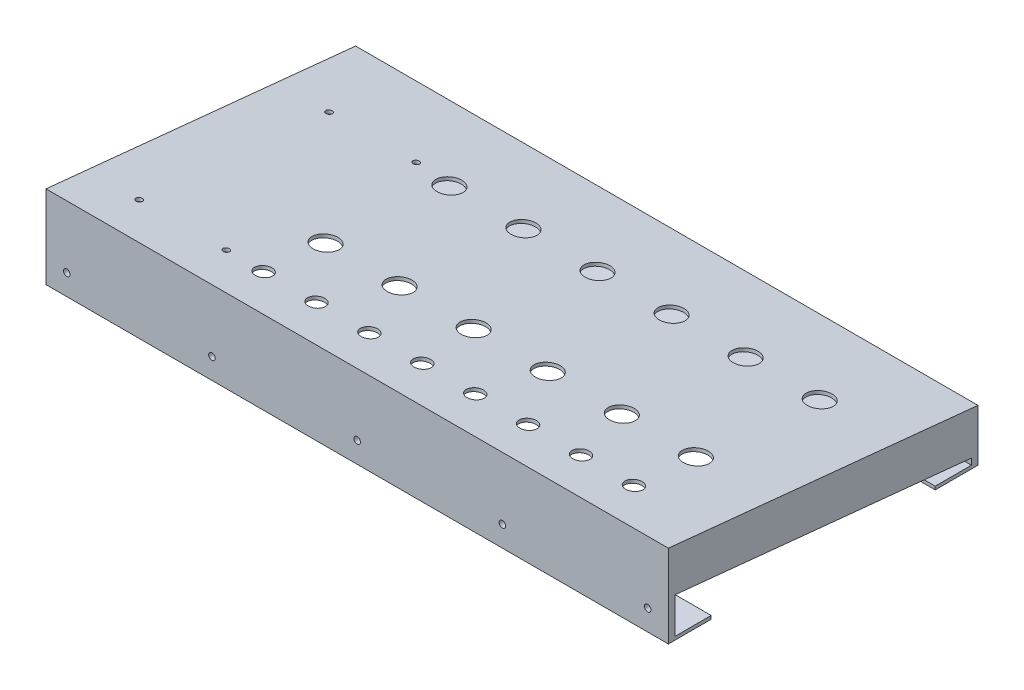
from build123d import *

# Parameters (mm, degrees)
BOSS_EXTRU_1_DEPTH      = 300
ESQUISSE3_W             = 300
ESQUISSE3_H             = 19.05
BOSS_EXTRU_2_DEPTH      = 1.5875
ESQUISSE4_W             = 300
ESQUISSE4_H             = 1.5875
BOSS_EXTRU_3_DEPTH      = 17.4625
ESQUISSE5_W             = 300
ESQUISSE5_H             = 19.05
BOSS_EXTRU_4_DEPTH      = 1.5875
ESQUISSE6_W             = 300
ESQUISSE6_H             = 1.5875
BOSS_EXTRU_5_DEPTH      = 17.4625
BOSS_EXTRU_6_DEPTH      = 19.05
BOSS_EXTRU_7_DEPTH      = 1.5875
BOSS_EXTRU_8_DEPTH      = 19.05
BOSS_EXTRU_9_DEPTH      = 1.5875
ESQUISSE12_R            = 1.5875
ENL_V_MAT_EXTRU_1_DEPTH = 336.963889684
ENL_V_MAT_EXTRU_2_REACH = 327.827
ESQUISSE13_R            = 4
ESQUISSE13_R_2          = 6
ESQUISSE13_R_3          = 1.5


with BuildPart() as part:
    # Esquisse1 → Boss.-Extru.1 (new body)
    with BuildSketch(Plane(origin=(0, 0, 0), x_dir=(0, 0, -1), z_dir=(1, 0, 0))):
        Polygon((-26.397970452, -24.428163497), (-26.397970452, 15.571836503), (122.850145114, 0.571836503), (122.850145114, -24.428163497), (121.262645114, -24.428163497), (121.262645114, -0.864111276), (-24.810470452, 13.816789218), (-24.810470452, -24.428163497), align=None)
    extrude(amount=BOSS_EXTRU_1_DEPTH)

    # Esquisse3 → Boss.-Extru.2 (add)
    with BuildSketch(Plane(origin=(0, 0, 24.810470452), x_dir=(-1, 0, 0), z_dir=(0, 0, -1))):
        with Locations((-150, -14.903163497)):
            Rectangle(ESQUISSE3_W, ESQUISSE3_H)
    extrude(amount=BOSS_EXTRU_2_DEPTH)

    # Esquisse4 → Boss.-Extru.3 (add)
    with BuildSketch(Plane(origin=(0, 0, 23.222970452), x_dir=(-1, 0, 0), z_dir=(0, 0, -1))):
        with Locations((-150, -23.634413497)):
            Rectangle(ESQUISSE4_W, ESQUISSE4_H)
    extrude(amount=BOSS_EXTRU_3_DEPTH)

    # Esquisse5 → Boss.-Extru.4 (add)
    with BuildSketch(Plane.XY.offset(-121.262645114)):
        with Locations((150, -14.903163497)):
            Rectangle(ESQUISSE5_W, ESQUISSE5_H)
    extrude(amount=BOSS_EXTRU_4_DEPTH)

    # Esquisse6 → Boss.-Extru.5 (add)
    with BuildSketch(Plane.XY.offset(-119.675145114)):
        with Locations((150, -23.634413497)):
            Rectangle(ESQUISSE6_W, ESQUISSE6_H)
    extrude(amount=BOSS_EXTRU_5_DEPTH)

    # Esquisse7 → Boss.-Extru.6 (add)
    with BuildSketch(Plane(origin=(300, 0, 0), x_dir=(0, 0, -1), z_dir=(1, 0, 0))):
        Polygon((-24.810470452, 13.816789218), (-24.810470452, 12.221291686), (121.262645114, -2.459608808), (121.262645114, -0.864111276), align=None)
    extrude(amount=-BOSS_EXTRU_6_DEPTH)

    # Esquisse8 → Boss.-Extru.7 (add)
    with BuildSketch(Plane(origin=(300, 0, 0), x_dir=(0, 0, -1), z_dir=(1, 0, 0))):
        Polygon((-24.810470452, 12.221291686), (121.262645114, -2.459608808), (121.262645114, -5.378163497), (119.675145114, -5.378163497), (119.675145114, -19.850531903), (-24.810470452, -5.329181163), align=None)
    extrude(amount=-BOSS_EXTRU_7_DEPTH)



with BuildPart() as body_2:
    # Esquisse9 → Boss.-Extru.8 (new body)
    with BuildSketch(Plane.ZY):
        Polygon((-121.262645114, -0.864111276), (24.810470452, 13.816789218), (24.810470452, 12.221291686), (-121.262645114, -2.459608808), align=None)
    extrude(amount=-BOSS_EXTRU_8_DEPTH)


with BuildPart() as part_1:
    add(part.part)

    add(body_2.part)  # Boss.-Extru.9 merges body 2
    # Esquisse11 → Boss.-Extru.9 (add)
    with BuildSketch(Plane.ZY):
        Polygon((-121.262645114, -2.459608808), (-121.262645114, -5.378163497), (-119.675145114, -5.378163497), (-119.675145114, -19.850531903), (24.810470452, -5.329181163), (24.810470452, 12.221291686), align=None)
    extrude(amount=-BOSS_EXTRU_9_DEPTH)

    # Esquisse12 → Enlèv. mat.-Extru.1 (cut, through all)
    with BuildSketch(Plane(origin=(0, 0, -122.850145114), x_dir=(-1, 0, 0), z_dir=(0, 0, -1))):
        with Locations((-290, -14.428163497)):
            Circle(ESQUISSE12_R)
        with Locations((-150, -14.428163497)):
            Circle(ESQUISSE12_R)
        with Locations((-10, -14.428163497)):
            Circle(ESQUISSE12_R)
        with Locations((-220, -14.428163497)):
            Circle(ESQUISSE12_R)
        with Locations((-80, -14.428163497)):
            Circle(ESQUISSE12_R)
    extrude(amount=-ENL_V_MAT_EXTRU_1_DEPTH, mode=Mode.SUBTRACT)

    # Esquisse13 → Enlèv. mat.-Extru.2 (cut, up to next)
    with BuildSketch(Plane(origin=(0, 12.789553241, -1.285398465), x_dir=(1, 0, 0), z_dir=(0, 0.99498743710662, -0.09999999999999984)), mode=Mode.PRIVATE) as enl_v_mat_extru_2_sk1:
        with Locations((263.5, -7.822832615)):
            Circle(ESQUISSE13_R)
    enl_v_mat_extru_2_tool1 = extrude(enl_v_mat_extru_2_sk1.sketch, amount=-ENL_V_MAT_EXTRU_2_REACH, mode=Mode.PRIVATE) & part_1.part
    # Esquisse13 → Enlèv. mat.-Extru.2 (cut, up to next)
    with BuildSketch(Plane(origin=(0, 12.789553241, -1.285398465), x_dir=(1, 0, 0), z_dir=(0, 0.99498743710662, -0.09999999999999984)), mode=Mode.PRIVATE) as enl_v_mat_extru_2_sk2:
        with Locations((238, -7.822832615)):
            Circle(ESQUISSE13_R)
    enl_v_mat_extru_2_tool2 = extrude(enl_v_mat_extru_2_sk2.sketch, amount=-ENL_V_MAT_EXTRU_2_REACH, mode=Mode.PRIVATE) & part_1.part
    # Esquisse13 → Enlèv. mat.-Extru.2 (cut, up to next)
    with BuildSketch(Plane(origin=(0, 12.789553241, -1.285398465), x_dir=(1, 0, 0), z_dir=(0, 0.99498743710662, -0.09999999999999984)), mode=Mode.PRIVATE) as enl_v_mat_extru_2_sk3:
        with Locations((212.5, -7.822832615)):
            Circle(ESQUISSE13_R)
    enl_v_mat_extru_2_tool3 = extrude(enl_v_mat_extru_2_sk3.sketch, amount=-ENL_V_MAT_EXTRU_2_REACH, mode=Mode.PRIVATE) & part_1.part
    # Esquisse13 → Enlèv. mat.-Extru.2 (cut, up to next)
    with BuildSketch(Plane(origin=(0, 12.789553241, -1.285398465), x_dir=(1, 0, 0), z_dir=(0, 0.99498743710662, -0.09999999999999984)), mode=Mode.PRIVATE) as enl_v_mat_extru_2_sk4:
        with Locations((187, -7.822832615)):
            Circle(ESQUISSE13_R)
    enl_v_mat_extru_2_tool4 = extrude(enl_v_mat_extru_2_sk4.sketch, amount=-ENL_V_MAT_EXTRU_2_REACH, mode=Mode.PRIVATE) & part_1.part
    # Esquisse13 → Enlèv. mat.-Extru.2 (cut, up to next)
    with BuildSketch(Plane(origin=(0, 12.789553241, -1.285398465), x_dir=(1, 0, 0), z_dir=(0, 0.99498743710662, -0.09999999999999984)), mode=Mode.PRIVATE) as enl_v_mat_extru_2_sk5:
        with Locations((161.5, -7.822832615)):
            Circle(ESQUISSE13_R)
    enl_v_mat_extru_2_tool5 = extrude(enl_v_mat_extru_2_sk5.sketch, amount=-ENL_V_MAT_EXTRU_2_REACH, mode=Mode.PRIVATE) & part_1.part
    # Esquisse13 → Enlèv. mat.-Extru.2 (cut, up to next)
    with BuildSketch(Plane(origin=(0, 12.789553241, -1.285398465), x_dir=(1, 0, 0), z_dir=(0, 0.99498743710662, -0.09999999999999984)), mode=Mode.PRIVATE) as enl_v_mat_extru_2_sk6:
        with Locations((136, -7.822832615)):
            Circle(ESQUISSE13_R)
    enl_v_mat_extru_2_tool6 = extrude(enl_v_mat_extru_2_sk6.sketch, amount=-ENL_V_MAT_EXTRU_2_REACH, mode=Mode.PRIVATE) & part_1.part
    # Esquisse13 → Enlèv. mat.-Extru.2 (cut, up to next)
    with BuildSketch(Plane(origin=(0, 12.789553241, -1.285398465), x_dir=(1, 0, 0), z_dir=(0, 0.99498743710662, -0.09999999999999984)), mode=Mode.PRIVATE) as enl_v_mat_extru_2_sk7:
        with Locations((110.5, -7.822832615)):
            Circle(ESQUISSE13_R)
    enl_v_mat_extru_2_tool7 = extrude(enl_v_mat_extru_2_sk7.sketch, amount=-ENL_V_MAT_EXTRU_2_REACH, mode=Mode.PRIVATE) & part_1.part
    # Esquisse13 → Enlèv. mat.-Extru.2 (cut, up to next)
    with BuildSketch(Plane(origin=(0, 12.789553241, -1.285398465), x_dir=(1, 0, 0), z_dir=(0, 0.99498743710662, -0.09999999999999984)), mode=Mode.PRIVATE) as enl_v_mat_extru_2_sk8:
        with Locations((85, -7.822832615)):
            Circle(ESQUISSE13_R)
    enl_v_mat_extru_2_tool8 = extrude(enl_v_mat_extru_2_sk8.sketch, amount=-ENL_V_MAT_EXTRU_2_REACH, mode=Mode.PRIVATE) & part_1.part
    # Esquisse13 → Enlèv. mat.-Extru.2 (cut, up to next)
    with BuildSketch(Plane(origin=(0, 12.789553241, -1.285398465), x_dir=(1, 0, 0), z_dir=(0, 0.99498743710662, -0.09999999999999984)), mode=Mode.PRIVATE) as enl_v_mat_extru_2_sk9:
        with Locations((263.5, 22.177167385)):
            Circle(ESQUISSE13_R_2)
    enl_v_mat_extru_2_tool9 = extrude(enl_v_mat_extru_2_sk9.sketch, amount=-ENL_V_MAT_EXTRU_2_REACH, mode=Mode.PRIVATE) & part_1.part
    # Esquisse13 → Enlèv. mat.-Extru.2 (cut, up to next)
    with BuildSketch(Plane(origin=(0, 12.789553241, -1.285398465), x_dir=(1, 0, 0), z_dir=(0, 0.99498743710662, -0.09999999999999984)), mode=Mode.PRIVATE) as enl_v_mat_extru_2_sk10:
        with Locations((227.8, 22.177167385)):
            Circle(ESQUISSE13_R_2)
    enl_v_mat_extru_2_tool10 = extrude(enl_v_mat_extru_2_sk10.sketch, amount=-ENL_V_MAT_EXTRU_2_REACH, mode=Mode.PRIVATE) & part_1.part
    # Esquisse13 → Enlèv. mat.-Extru.2 (cut, up to next)
    with BuildSketch(Plane(origin=(0, 12.789553241, -1.285398465), x_dir=(1, 0, 0), z_dir=(0, 0.99498743710662, -0.09999999999999984)), mode=Mode.PRIVATE) as enl_v_mat_extru_2_sk11:
        with Locations((192.1, 22.177167385)):
            Circle(ESQUISSE13_R_2)
    enl_v_mat_extru_2_tool11 = extrude(enl_v_mat_extru_2_sk11.sketch, amount=-ENL_V_MAT_EXTRU_2_REACH, mode=Mode.PRIVATE) & part_1.part
    # Esquisse13 → Enlèv. mat.-Extru.2 (cut, up to next)
    with BuildSketch(Plane(origin=(0, 12.789553241, -1.285398465), x_dir=(1, 0, 0), z_dir=(0, 0.99498743710662, -0.09999999999999984)), mode=Mode.PRIVATE) as enl_v_mat_extru_2_sk12:
        with Locations((156.4, 22.177167385)):
            Circle(ESQUISSE13_R_2)
    enl_v_mat_extru_2_tool12 = extrude(enl_v_mat_extru_2_sk12.sketch, amount=-ENL_V_MAT_EXTRU_2_REACH, mode=Mode.PRIVATE) & part_1.part
    # Esquisse13 → Enlèv. mat.-Extru.2 (cut, up to next)
    with BuildSketch(Plane(origin=(0, 12.789553241, -1.285398465), x_dir=(1, 0, 0), z_dir=(0, 0.99498743710662, -0.09999999999999984)), mode=Mode.PRIVATE) as enl_v_mat_extru_2_sk13:
        with Locations((120.7, 22.177167385)):
            Circle(ESQUISSE13_R_2)
    enl_v_mat_extru_2_tool13 = extrude(enl_v_mat_extru_2_sk13.sketch, amount=-ENL_V_MAT_EXTRU_2_REACH, mode=Mode.PRIVATE) & part_1.part
    # Esquisse13 → Enlèv. mat.-Extru.2 (cut, up to next)
    with BuildSketch(Plane(origin=(0, 12.789553241, -1.285398465), x_dir=(1, 0, 0), z_dir=(0, 0.99498743710662, -0.09999999999999984)), mode=Mode.PRIVATE) as enl_v_mat_extru_2_sk14:
        with Locations((85, 22.177167385)):
            Circle(ESQUISSE13_R_2)
    enl_v_mat_extru_2_tool14 = extrude(enl_v_mat_extru_2_sk14.sketch, amount=-ENL_V_MAT_EXTRU_2_REACH, mode=Mode.PRIVATE) & part_1.part
    # Esquisse13 → Enlèv. mat.-Extru.2 (cut, up to next)
    with BuildSketch(Plane(origin=(0, 12.789553241, -1.285398465), x_dir=(1, 0, 0), z_dir=(0, 0.99498743710662, -0.09999999999999984)), mode=Mode.PRIVATE) as enl_v_mat_extru_2_sk15:
        with Locations((227.8, 82.177167385)):
            Circle(ESQUISSE13_R_2)
    enl_v_mat_extru_2_tool15 = extrude(enl_v_mat_extru_2_sk15.sketch, amount=-ENL_V_MAT_EXTRU_2_REACH, mode=Mode.PRIVATE) & part_1.part
    # Esquisse13 → Enlèv. mat.-Extru.2 (cut, up to next)
    with BuildSketch(Plane(origin=(0, 12.789553241, -1.285398465), x_dir=(1, 0, 0), z_dir=(0, 0.99498743710662, -0.09999999999999984)), mode=Mode.PRIVATE) as enl_v_mat_extru_2_sk16:
        with Locations((192.1, 82.177167385)):
            Circle(ESQUISSE13_R_2)
    enl_v_mat_extru_2_tool16 = extrude(enl_v_mat_extru_2_sk16.sketch, amount=-ENL_V_MAT_EXTRU_2_REACH, mode=Mode.PRIVATE) & part_1.part
    # Esquisse13 → Enlèv. mat.-Extru.2 (cut, up to next)
    with BuildSketch(Plane(origin=(0, 12.789553241, -1.285398465), x_dir=(1, 0, 0), z_dir=(0, 0.99498743710662, -0.09999999999999984)), mode=Mode.PRIVATE) as enl_v_mat_extru_2_sk17:
        with Locations((156.4, 82.177167385)):
            Circle(ESQUISSE13_R_2)
    enl_v_mat_extru_2_tool17 = extrude(enl_v_mat_extru_2_sk17.sketch, amount=-ENL_V_MAT_EXTRU_2_REACH, mode=Mode.PRIVATE) & part_1.part
    # Esquisse13 → Enlèv. mat.-Extru.2 (cut, up to next)
    with BuildSketch(Plane(origin=(0, 12.789553241, -1.285398465), x_dir=(1, 0, 0), z_dir=(0, 0.99498743710662, -0.09999999999999984)), mode=Mode.PRIVATE) as enl_v_mat_extru_2_sk18:
        with Locations((120.7, 82.177167385)):
            Circle(ESQUISSE13_R_2)
    enl_v_mat_extru_2_tool18 = extrude(enl_v_mat_extru_2_sk18.sketch, amount=-ENL_V_MAT_EXTRU_2_REACH, mode=Mode.PRIVATE) & part_1.part
    # Esquisse13 → Enlèv. mat.-Extru.2 (cut, up to next)
    with BuildSketch(Plane(origin=(0, 12.789553241, -1.285398465), x_dir=(1, 0, 0), z_dir=(0, 0.99498743710662, -0.09999999999999984)), mode=Mode.PRIVATE) as enl_v_mat_extru_2_sk19:
        with Locations((85, 82.177167385)):
            Circle(ESQUISSE13_R_2)
    enl_v_mat_extru_2_tool19 = extrude(enl_v_mat_extru_2_sk19.sketch, amount=-ENL_V_MAT_EXTRU_2_REACH, mode=Mode.PRIVATE) & part_1.part
    # Esquisse13 → Enlèv. mat.-Extru.2 (cut, up to next)
    with BuildSketch(Plane(origin=(0, 12.789553241, -1.285398465), x_dir=(1, 0, 0), z_dir=(0, 0.99498743710662, -0.09999999999999984)), mode=Mode.PRIVATE) as enl_v_mat_extru_2_sk20:
        with Locations((263.5, 82.177167385)):
            Circle(ESQUISSE13_R_2)
    enl_v_mat_extru_2_tool20 = extrude(enl_v_mat_extru_2_sk20.sketch, amount=-ENL_V_MAT_EXTRU_2_REACH, mode=Mode.PRIVATE) & part_1.part
    # Esquisse13 → Enlèv. mat.-Extru.2 (cut, up to next)
    with BuildSketch(Plane(origin=(0, 12.789553241, -1.285398465), x_dir=(1, 0, 0), z_dir=(0, 0.99498743710662, -0.09999999999999984)), mode=Mode.PRIVATE) as enl_v_mat_extru_2_sk21:
        with Locations((67, -7.822832615)):
            Circle(ESQUISSE13_R_3)
    enl_v_mat_extru_2_tool21 = extrude(enl_v_mat_extru_2_sk21.sketch, amount=-ENL_V_MAT_EXTRU_2_REACH, mode=Mode.PRIVATE) & part_1.part
    # Esquisse13 → Enlèv. mat.-Extru.2 (cut, up to next)
    with BuildSketch(Plane(origin=(0, 12.789553241, -1.285398465), x_dir=(1, 0, 0), z_dir=(0, 0.99498743710662, -0.09999999999999984)), mode=Mode.PRIVATE) as enl_v_mat_extru_2_sk22:
        with Locations((25, -7.822832615)):
            Circle(ESQUISSE13_R_3)
    enl_v_mat_extru_2_tool22 = extrude(enl_v_mat_extru_2_sk22.sketch, amount=-ENL_V_MAT_EXTRU_2_REACH, mode=Mode.PRIVATE) & part_1.part
    # Esquisse13 → Enlèv. mat.-Extru.2 (cut, up to next)
    with BuildSketch(Plane(origin=(0, 12.789553241, -1.285398465), x_dir=(1, 0, 0), z_dir=(0, 0.99498743710662, -0.09999999999999984)), mode=Mode.PRIVATE) as enl_v_mat_extru_2_sk23:
        with Locations((67, 84.177167385)):
            Circle(ESQUISSE13_R_3)
    enl_v_mat_extru_2_tool23 = extrude(enl_v_mat_extru_2_sk23.sketch, amount=-ENL_V_MAT_EXTRU_2_REACH, mode=Mode.PRIVATE) & part_1.part
    # Esquisse13 → Enlèv. mat.-Extru.2 (cut, up to next)
    with BuildSketch(Plane(origin=(0, 12.789553241, -1.285398465), x_dir=(1, 0, 0), z_dir=(0, 0.99498743710662, -0.09999999999999984)), mode=Mode.PRIVATE) as enl_v_mat_extru_2_sk24:
        with Locations((25, 84.177167385)):
            Circle(ESQUISSE13_R_3)
    enl_v_mat_extru_2_tool24 = extrude(enl_v_mat_extru_2_sk24.sketch, amount=-ENL_V_MAT_EXTRU_2_REACH, mode=Mode.PRIVATE) & part_1.part
    add(enl_v_mat_extru_2_tool1.solids().sort_by_distance((263.5, 13.571837, 6.498222))[0], mode=Mode.SUBTRACT)
    add(enl_v_mat_extru_2_tool2.solids().sort_by_distance((238, 13.571837, 6.498222))[0], mode=Mode.SUBTRACT)
    add(enl_v_mat_extru_2_tool3.solids().sort_by_distance((212.5, 13.571837, 6.498222))[0], mode=Mode.SUBTRACT)
    add(enl_v_mat_extru_2_tool4.solids().sort_by_distance((187, 13.571837, 6.498222))[0], mode=Mode.SUBTRACT)
    add(enl_v_mat_extru_2_tool5.solids().sort_by_distance((161.5, 13.571837, 6.498222))[0], mode=Mode.SUBTRACT)
    add(enl_v_mat_extru_2_tool6.solids().sort_by_distance((136, 13.571837, 6.498222))[0], mode=Mode.SUBTRACT)
    add(enl_v_mat_extru_2_tool7.solids().sort_by_distance((110.5, 13.571837, 6.498222))[0], mode=Mode.SUBTRACT)
    add(enl_v_mat_extru_2_tool8.solids().sort_by_distance((85, 13.571837, 6.498222))[0], mode=Mode.SUBTRACT)
    add(enl_v_mat_extru_2_tool9.solids().sort_by_distance((263.5, 10.571837, -23.351401))[0], mode=Mode.SUBTRACT)
    add(enl_v_mat_extru_2_tool10.solids().sort_by_distance((227.8, 10.571837, -23.351401))[0], mode=Mode.SUBTRACT)
    add(enl_v_mat_extru_2_tool11.solids().sort_by_distance((192.1, 10.571837, -23.351401))[0], mode=Mode.SUBTRACT)
    add(enl_v_mat_extru_2_tool12.solids().sort_by_distance((156.4, 10.571837, -23.351401))[0], mode=Mode.SUBTRACT)
    add(enl_v_mat_extru_2_tool13.solids().sort_by_distance((120.7, 10.571837, -23.351401))[0], mode=Mode.SUBTRACT)
    add(enl_v_mat_extru_2_tool14.solids().sort_by_distance((85, 10.571837, -23.351401))[0], mode=Mode.SUBTRACT)
    add(enl_v_mat_extru_2_tool15.solids().sort_by_distance((227.8, 4.571837, -83.050648))[0], mode=Mode.SUBTRACT)
    add(enl_v_mat_extru_2_tool16.solids().sort_by_distance((192.1, 4.571837, -83.050648))[0], mode=Mode.SUBTRACT)
    add(enl_v_mat_extru_2_tool17.solids().sort_by_distance((156.4, 4.571837, -83.050648))[0], mode=Mode.SUBTRACT)
    add(enl_v_mat_extru_2_tool18.solids().sort_by_distance((120.7, 4.571837, -83.050648))[0], mode=Mode.SUBTRACT)
    add(enl_v_mat_extru_2_tool19.solids().sort_by_distance((85, 4.571837, -83.050648))[0], mode=Mode.SUBTRACT)
    add(enl_v_mat_extru_2_tool20.solids().sort_by_distance((263.5, 4.571837, -83.050648))[0], mode=Mode.SUBTRACT)
    add(enl_v_mat_extru_2_tool21.solids().sort_by_distance((67, 13.571837, 6.498222))[0], mode=Mode.SUBTRACT)
    add(enl_v_mat_extru_2_tool22.solids().sort_by_distance((25, 13.571837, 6.498222))[0], mode=Mode.SUBTRACT)
    add(enl_v_mat_extru_2_tool23.solids().sort_by_distance((67, 4.371837, -85.040623))[0], mode=Mode.SUBTRACT)
    add(enl_v_mat_extru_2_tool24.solids().sort_by_distance((25, 4.371837, -85.040623))[0], mode=Mode.SUBTRACT)


solid = part_1.part
